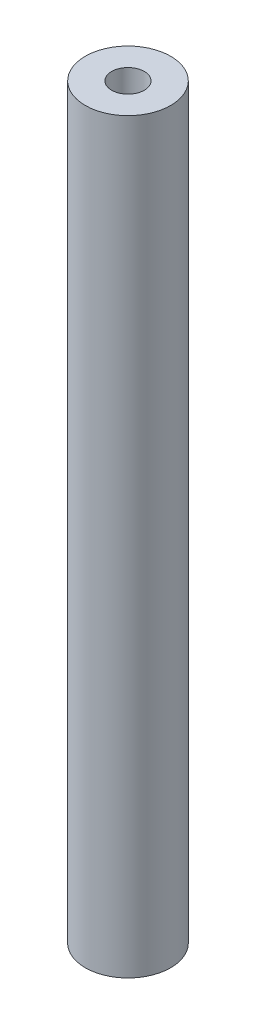
from build123d import *

# Parameters (mm, degrees)
SKETCH1_R           = 2
SKETCH1_R_2         = 0.765
BOSS_EXTRUDE1_DEPTH = 17.5


with BuildPart() as part:
    # Sketch1 → Boss-Extrude1 (new, symmetric)
    with BuildSketch(Plane(origin=(0, 0, 0), x_dir=(1, 0, 0), z_dir=(0, 1, 0))):
        Circle(SKETCH1_R)
        Circle(SKETCH1_R_2, mode=Mode.SUBTRACT)
    extrude(amount=BOSS_EXTRUDE1_DEPTH, both=True)


solid = part.part
